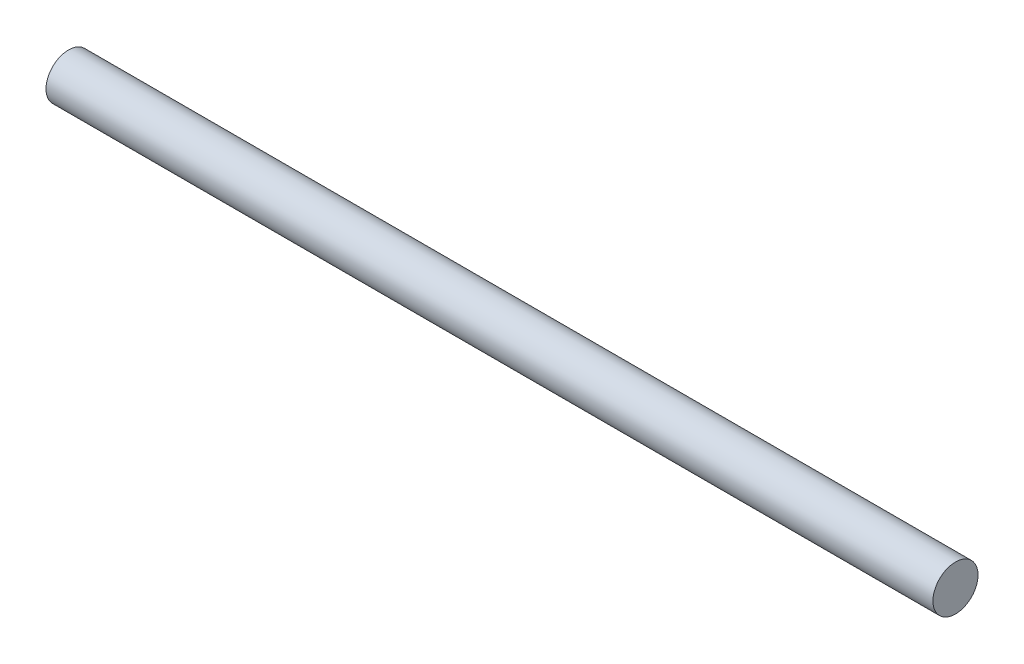
from build123d import *

# Parameters (mm, degrees)
CROQUIS1_R              = 4.7625
SALIENTE_EXTRUIR1_DEPTH = 187.24


with BuildPart() as part:
    # Croquis1 → Saliente-Extruir1 (new body)
    with BuildSketch(Plane(origin=(0, 0, 0), x_dir=(0, 0, -1), z_dir=(1, 0, 0))):
        Circle(CROQUIS1_R)
    extrude(amount=SALIENTE_EXTRUIR1_DEPTH)


solid = part.part
